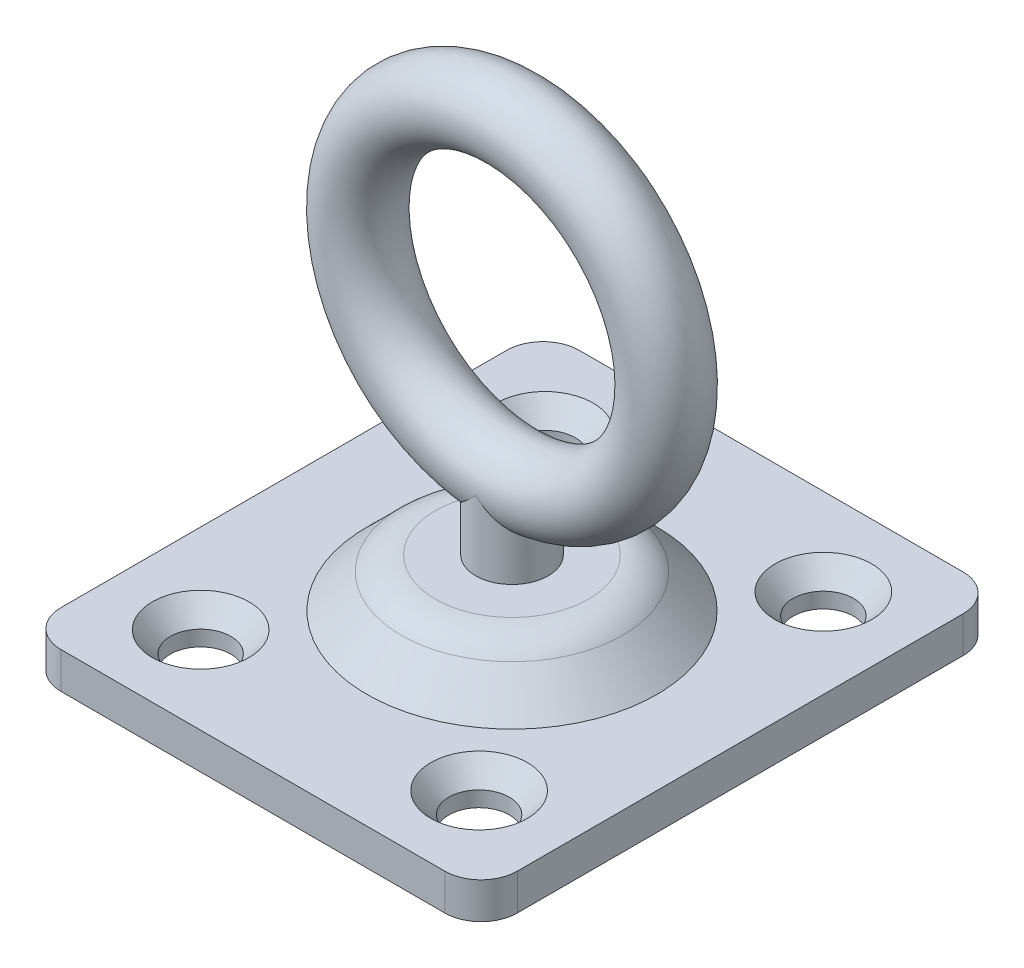
from build123d import *

# Parameters (mm, degrees)
BOSS_EXTRUDE1_DEPTH = 2.38125
CUT_EXTRUDE1_REACH  = 24.801
SKETCH2_R           = 1.984375
SKETCH6_R           = 4.7625
SKETCH6_R_2         = 2.38125
BOSS_EXTRUDE2_DEPTH = 1.190625
SKETCH9_R           = 2.38125


with BuildPart() as part:
    # Sketch1 → Boss-Extrude1 (new body)
    with BuildSketch(Plane(origin=(0, 0, 0), x_dir=(1, 0, 0), z_dir=(0, 1, 0))):
        with BuildLine():
            Line((-12.60475, 17.018), (12.60475, 17.018))
            ThreePointArc((12.60475, 17.018), (14.288548023, 16.320548023), (14.986, 14.63675))
            Line((14.986, 14.63675), (14.986, -14.63675))
            ThreePointArc((14.986, -14.63675), (14.288548023, -16.320548023), (12.60475, -17.018))
            Line((12.60475, -17.018), (-12.60475, -17.018))
            ThreePointArc((-12.60475, -17.018), (-14.288548023, -16.320548023), (-14.986, -14.63675))
            Line((-14.986, -14.63675), (-14.986, 14.63675))
            ThreePointArc((-14.986, 14.63675), (-14.288548023, 16.320548023), (-12.60475, 17.018))
        make_face()
    extrude(amount=BOSS_EXTRUDE1_DEPTH)

    # Sketch2 → Cut-Extrude1 (cut, up to next)
    with BuildSketch(Plane(origin=(0, 0, 0), x_dir=(1, 0, 0), z_dir=(0, 1, 0)), mode=Mode.PRIVATE) as cut_extrude1_sk1:
        with Locations((-9.144, 11.303)):
            Circle(SKETCH2_R)
    cut_extrude1_tool1 = extrude(cut_extrude1_sk1.sketch, amount=CUT_EXTRUDE1_REACH, mode=Mode.PRIVATE) & part.part
    # Sketch2 → Cut-Extrude1 (cut, up to next)
    with BuildSketch(Plane(origin=(0, 0, 0), x_dir=(1, 0, 0), z_dir=(0, 1, 0)), mode=Mode.PRIVATE) as cut_extrude1_sk2:
        with Locations((9.144, 11.303)):
            Circle(SKETCH2_R)
    cut_extrude1_tool2 = extrude(cut_extrude1_sk2.sketch, amount=CUT_EXTRUDE1_REACH, mode=Mode.PRIVATE) & part.part
    # Sketch2 → Cut-Extrude1 (cut, up to next)
    with BuildSketch(Plane(origin=(0, 0, 0), x_dir=(1, 0, 0), z_dir=(0, 1, 0)), mode=Mode.PRIVATE) as cut_extrude1_sk3:
        with Locations((9.144, -11.303)):
            Circle(SKETCH2_R)
    cut_extrude1_tool3 = extrude(cut_extrude1_sk3.sketch, amount=CUT_EXTRUDE1_REACH, mode=Mode.PRIVATE) & part.part
    # Sketch2 → Cut-Extrude1 (cut, up to next)
    with BuildSketch(Plane(origin=(0, 0, 0), x_dir=(1, 0, 0), z_dir=(0, 1, 0)), mode=Mode.PRIVATE) as cut_extrude1_sk4:
        with Locations((-9.144, -11.303)):
            Circle(SKETCH2_R)
    cut_extrude1_tool4 = extrude(cut_extrude1_sk4.sketch, amount=CUT_EXTRUDE1_REACH, mode=Mode.PRIVATE) & part.part
    add(cut_extrude1_tool1.solids().sort_by_distance((-9.144, 0, -11.303))[0], mode=Mode.SUBTRACT)
    add(cut_extrude1_tool2.solids().sort_by_distance((9.144, 0, -11.303))[0], mode=Mode.SUBTRACT)
    add(cut_extrude1_tool3.solids().sort_by_distance((9.144, 0, 11.303))[0], mode=Mode.SUBTRACT)
    add(cut_extrude1_tool4.solids().sort_by_distance((-9.144, 0, 11.303))[0], mode=Mode.SUBTRACT)

    # Cut-Extrude2 cone 1 section (through the dimple's axis) → Cut-Extrude2 (revolve, cut)
    with BuildSketch(Plane(origin=(-9.144, 2.38125, -11.303), x_dir=(0, 0, 1), z_dir=(1, 0, 0))):
        Polygon((0, 0), (3.175, 0), (0, 3.652419693), align=None)
    revolve(axis=Axis((-9.144, 2.38125, -11.303), (0, -1, 0)), mode=Mode.SUBTRACT)

    # Cut-Extrude2 cone 2 section (through the dimple's axis) → Cut-Extrude2 cone 2 (revolve, cut)
    with BuildSketch(Plane(origin=(9.144, 2.38125, -11.303), x_dir=(0, 0, 1), z_dir=(1, 0, 0))):
        Polygon((0, 0), (3.175, 0), (0, 3.652419693), align=None)
    revolve(axis=Axis((9.144, 2.38125, -11.303), (0, -1, 0)), mode=Mode.SUBTRACT)

    # Cut-Extrude2 cone 3 section (through the dimple's axis) → Cut-Extrude2 cone 3 (revolve, cut)
    with BuildSketch(Plane(origin=(9.144, 2.38125, 11.303), x_dir=(0, 0, 1), z_dir=(1, 0, 0))):
        Polygon((0, 0), (3.175, 0), (0, 3.652419693), align=None)
    revolve(axis=Axis((9.144, 2.38125, 11.303), (0, -1, 0)), mode=Mode.SUBTRACT)

    # Cut-Extrude2 cone 4 section (through the dimple's axis) → Cut-Extrude2 cone 4 (revolve, cut)
    with BuildSketch(Plane(origin=(-9.144, 2.38125, 11.303), x_dir=(0, 0, 1), z_dir=(1, 0, 0))):
        Polygon((0, 0), (3.175, 0), (0, 3.652419693), align=None)
    revolve(axis=Axis((-9.144, 2.38125, 11.303), (0, -1, 0)), mode=Mode.SUBTRACT)

    # Sketch4 → Revolve1 (revolve)
    with BuildSketch(Plane.XY):
        with BuildLine():
            Line((-9.525, 2.38125), (-7.27993597, 4.62631403))
            ThreePointArc((-7.27993597, 4.62631403), (-6.249891837, 5.314567516), (-5.034871939, 5.55625))
            Line((-5.034871939, 5.55625), (0, 5.55625))
            Line((0, 5.55625), (0, 2.38125))
            Line((0, 2.38125), (-9.525, 2.38125))
        make_face()
    revolve(axis=Axis((0, 0, 0), (0, 1, 0)))

    # Sketch5 → Cut-Revolve1 (revolve, cut)
    with BuildSketch(Plane.XY):
        with BuildLine():
            Line((0, 5.55625), (-2.38125, 5.55625))
            Line((-2.38125, 5.55625), (-2.38125, 3.175))
            Line((-2.38125, 3.175), (-5.034871939, 3.175))
            ThreePointArc((-5.034871939, 3.175), (-5.338626914, 3.114579379), (-5.596137947, 2.942516008))
            Line((-5.596137947, 2.942516008), (-7.841201977, 0.697451977))
            ThreePointArc((-7.841201977, 0.697451977), (-8.613735077, 0.181261863), (-9.525, 0))
            Line((-9.525, 0), (0, 0))
            Line((0, 0), (0, 5.55625))
        make_face()
    revolve(axis=Axis((0, 32.766, 0), (0, -1, 0)), mode=Mode.SUBTRACT)


with BuildPart() as body_2:
    # Sketch6 → Boss-Extrude2 (new body)
    with BuildSketch(Plane.XZ.offset(-3.175)):
        Circle(SKETCH6_R)
        Circle(SKETCH6_R_2, mode=Mode.SUBTRACT)
    extrude(amount=BOSS_EXTRUDE2_DEPTH)


with BuildPart() as body_3:
    # Sketch7 → Revolve2 (revolve)
    with BuildSketch(Plane.XY):
        with BuildLine():
            Line((-2.38125, 10.12825), (-2.38125, 1.984375))
            Line((-2.38125, 1.984375), (-3.175, 1.984375))
            ThreePointArc((-3.175, 1.984375), (-1.695450743, 1.101193851), (0, 0.79375))
            Line((0, 0.79375), (0, 10.12825))
            Line((0, 10.12825), (-2.38125, 10.12825))
        make_face()
    revolve(axis=Axis((0, 32.766, 0), (0, -1, 0)))

    # Sweep1: sweep along a path in Sketch8
    with BuildLine(Plane.XY) as sweep1_path:
        CenterArc((0, 20.2565), 10.12825, 0, 360)
    # Sketch9 → Sweep1 (sweep)
    with BuildSketch(Plane(origin=(0, 0, 0), x_dir=(0, 0, -1), z_dir=(1, 0, 0))):
        with Locations((0, 30.38475)):
            Circle(SKETCH9_R)
    sweep(path=sweep1_path.line)


solid = Compound([part.part, body_2.part, body_3.part])
